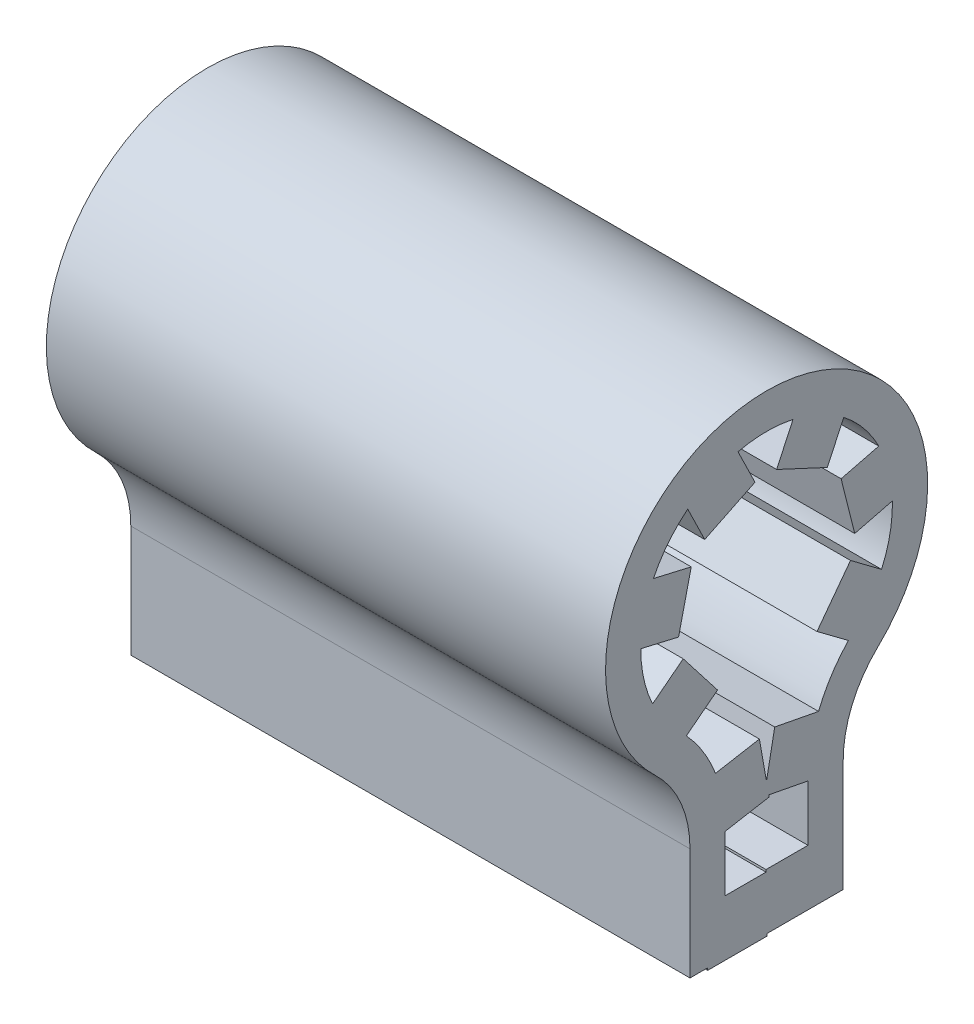
from build123d import *

# Parameters (mm, degrees)
BOSS_EXTRUDE1_DEPTH = 5
BOSS_EXTRUDE2_DEPTH = 10
CRVPATTERN1_START   = -5
CRVPATTERN1_DEPTH   = 10


# Read off the part's stored shape, not the designer's step: CrvPattern1
with BuildPart() as part:
    # Sketch1 → Boss-Extrude1 (new, symmetric)
    with BuildSketch(Plane(origin=(0, 0, 0), x_dir=(0, 0, -1), z_dir=(1, 0, 0))):
        with BuildLine():
            Line((-0.74, -4.899518381), (-0.74, -3.529518381))
            ThreePointArc((-0.74, -3.529518381), (-0.951991552, -2.495045015), (-1.553790984, -1.627339417))
            ThreePointArc((-1.553790984, -1.627339417), (0, 2.25), (1.553790984, -1.627339417))
            ThreePointArc((1.553790984, -1.627339417), (0.951991552, -2.495045015), (0.74, -3.529518381))
            Line((0.74, -3.529518381), (0.74, -4.899518381))
            Line((0.74, -4.899518381), (0.74, -5.529518381))
            Line((0.74, -5.529518381), (1.37, -5.529518381))
            Line((1.37, -5.529518381), (1.37, -3.529518381))
            ThreePointArc((1.37, -3.529518381), (1.531210305, -2.74284662), (1.988852459, -2.082994454))
            ThreePointArc((1.988852459, -2.082994454), (0, 2.88), (-1.988852459, -2.082994454))
            ThreePointArc((-1.988852459, -2.082994454), (-1.531210305, -2.74284662), (-1.37, -3.529518381))
            Line((-1.37, -3.529518381), (-1.37, -5.529518381))
            Line((-1.37, -5.529518381), (-0.74, -5.529518381))
            Line((-0.74, -5.529518381), (-0.74, -4.899518381))
        make_face()
    extrude(amount=BOSS_EXTRUDE1_DEPTH, both=True)

    # Sketch2 → Boss-Extrude2 (add)
    with BuildSketch(Plane(origin=(5, 0, 0), x_dir=(0, 0, -1), z_dir=(1, 0, 0))):
        Polygon((0.74, -5.529518381), (-0.01, -5.529518381), (-0.01, -4.529518381), (1.055, -4.529518381), (1.055, -5.529518381), align=None)
    extrude(amount=-BOSS_EXTRUDE2_DEPTH)

    # CrvPattern1 outline → CrvPattern1 (add)
    with BuildSketch(Plane.YZ.offset(CRVPATTERN1_START)):
        with BuildLine():
            Line((-3.434132874, -0.045450425), (-3.397683617, -0.03901399))
            Line((-3.397683617, -0.03901399), (-3.532580052, -0.74))
            Line((-3.532580052, -0.74), (-3.529518381, -0.74))
            ThreePointArc((-3.529518381, -0.74), (-3.03102155, -0.78767529), (-2.550597709, -0.928972692))
            Line((-2.550597709, -0.928972692), (-2.399805364, -0.145383976))
            Line((-2.399805364, -0.145383976), (-3.165558429, 0.00197611))
            Line((-3.165558429, 0.00197611), (-2.449368801, 0.128445298))
            Line((-2.449368801, 0.128445298), (-2.588131662, 0.914253465))
            ThreePointArc((-2.588131662, 0.914253465), (-3.050829227, 0.783930261), (-3.529518381, 0.74))
            Line((-3.529518381, 0.74), (-3.572832561, 0.74))
            Line((-3.572832561, 0.74), (-3.434132874, -0.045450425))
        make_face()
        Polygon((-4.569835686, 0.01), (-4.569835686, 0.74), (-5.529518381, 0.74), (-5.529518381, 1.055), (-5.569835686, 1.055), (-5.569835686, -0.01), (-5.529518381, -0.01), (-5.529518381, 0.01), align=None)
        with BuildLine():
            Line((-1.299068151, -0.901344517), (-1.718974467, -1.462428052))
            ThreePointArc((-1.718974467, -1.462428052), (-1.672594961, -1.507545863), (-1.627339417, -1.553790984))
            ThreePointArc((-1.627339417, -1.553790984), (-1.295295274, -1.839758178), (-0.914118043, -2.055939737))
            Line((-0.914118043, -2.055939737), (-0.498447811, -1.500516504))
            Line((-0.498447811, -1.500516504), (-1.299068151, -0.901344517))
        make_face()
        with BuildLine():
            ThreePointArc((-1.627339417, 1.553790984), (-1.686697501, 1.493590875), (-1.747959826, 1.435329714))
            Line((-1.747959826, 1.435329714), (-1.315009752, 0.877923318))
            Line((-1.315009752, 0.877923318), (-0.525253811, 1.491344505))
            Line((-0.525253811, 1.491344505), (-0.950809299, 2.039230658))
            ThreePointArc((-0.950809299, 2.039230658), (-1.311726198, 1.828079424), (-1.627339417, 1.553790984))
        make_face()
        with BuildLine():
            Line((-0.118991671, -1.576654998), (0.050236755, -2.249439101))
            ThreePointArc((0.050236755, -2.249439101), (0.548855993, -2.182030499), (1.020028088, -2.005503104))
            Line((1.020028088, -2.005503104), (0.850799662, -1.332719001))
            Line((0.850799662, -1.332719001), (-0.118991671, -1.576654998))
        make_face()
        with BuildLine():
            ThreePointArc((0.983930045, 2.023457849), (0.509670601, 2.191514517), (0.009923593, 2.249978116))
            Line((0.009923593, 2.249978116), (-0.147222825, 1.574269812))
            Line((-0.147222825, 1.574269812), (0.826783627, 1.347749545))
            Line((0.826783627, 1.347749545), (0.983930045, 2.023457849))
        make_face()
        with BuildLine():
            Line((1.149073188, -1.086108101), (1.77806433, -1.378762938))
            ThreePointArc((1.77806433, -1.378762938), (2.03999745, -0.949163002), (2.199914553, -0.472097404))
            Line((2.199914553, -0.472097404), (1.570923411, -0.179442568))
            Line((1.570923411, -0.179442568), (1.149073188, -1.086108101))
        make_face()
        with BuildLine():
            ThreePointArc((2.191102417, 0.511439339), (2.022663, 0.98556298), (1.753074426, 1.410400673))
            Line((1.753074426, 1.410400673), (1.129428004, 1.106522654))
            Line((1.129428004, 1.106522654), (1.567455996, 0.20756132))
            Line((1.567455996, 0.20756132), (2.191102417, 0.511439339))
        make_face()
    extrude(amount=CRVPATTERN1_DEPTH)


solid = part.part
